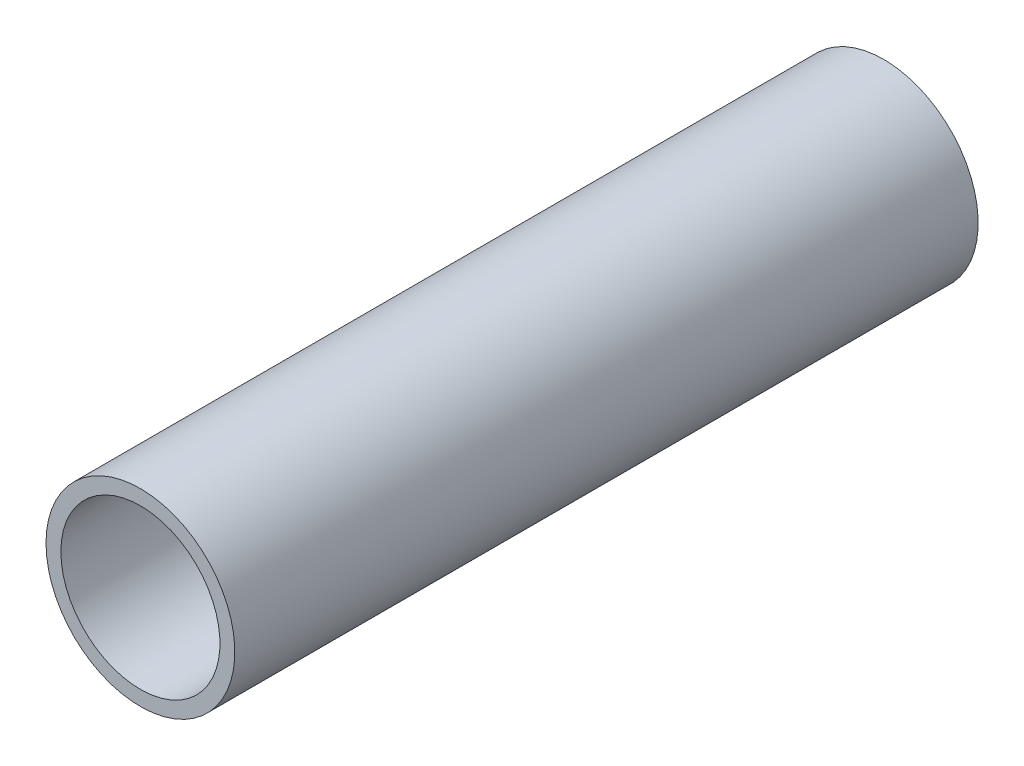
from build123d import *

# Parameters (mm, degrees)
SWEEP_THIN_PROFILE_R   = 6.35
SWEEP_THIN_PROFILE_R_2 = 5.35


with BuildPart() as part:
    # Sweep-Thin: sweep along a path in Path
    with BuildLine(Plane(origin=(0, 0, 0), x_dir=(0, 0, -1), z_dir=(1, 0, 0))) as sweep_thin_path:
        Line((0, 0), (50, 0))
    # Sweep-Thin profile (on start of the path) → Sweep-Thin (sweep)
    with BuildSketch(Plane(origin=(0, 0, 0), x_dir=(-1, 0, 0), z_dir=(0, 0, -1))):
        Circle(SWEEP_THIN_PROFILE_R)
        Circle(SWEEP_THIN_PROFILE_R_2, mode=Mode.SUBTRACT)
    sweep(path=sweep_thin_path.line)


solid = part.part
